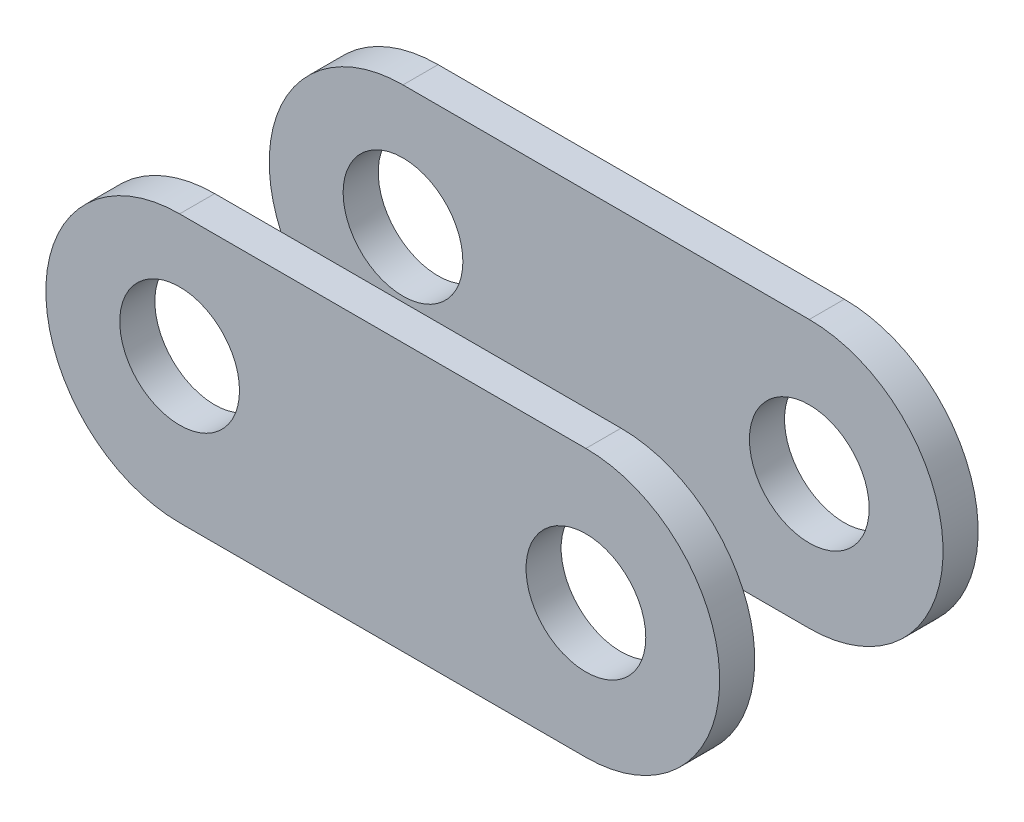
from build123d import *

# Parameters (mm, degrees)
BOSS_EXTRUDE1_DEPTH      = 3.9751
BOSS_EXTRUDE1_DEPTH_BACK = 3.9751
SKETCH2_R                = 1.8415
SKETCH3_W                = 20.7264
SKETCH3_H                = 5.7912
CUT_EXTRUDE1_DEPTH       = 17.369503444


with BuildPart() as part:
    # Sketch2 → Boss-Extrude1 (new, two sides: drawn at the far end of the back side and taken through both)
    with BuildSketch(Plane.XY.offset(-BOSS_EXTRUDE1_DEPTH_BACK)):
        with BuildLine():
            Line((-9.465807749, 4.1148), (3.030992251, 4.1148))
            ThreePointArc((3.030992251, 4.1148), (7.145792251, 0), (3.030992251, -4.1148))
            Line((3.030992251, -4.1148), (-9.465807749, -4.1148))
            ThreePointArc((-9.465807749, -4.1148), (-13.580607749, 0), (-9.465807749, 4.1148))
        make_face()
        with Locations((-9.465807749, 0.328058785)):
            Circle(SKETCH2_R, mode=Mode.SUBTRACT)
        with Locations((3.030992251, 0)):
            Circle(SKETCH2_R, mode=Mode.SUBTRACT)
    extrude(amount=BOSS_EXTRUDE1_DEPTH + BOSS_EXTRUDE1_DEPTH_BACK)

    # Sketch3 → Cut-Extrude1 (cut, through all)
    with BuildSketch(Plane(origin=(0, 4.1148, 0), x_dir=(1, 0, 0), z_dir=(0, 1, 0))):
        with Locations((-3.217407749, 0)):
            Rectangle(SKETCH3_W, SKETCH3_H)
    extrude(amount=-CUT_EXTRUDE1_DEPTH, mode=Mode.SUBTRACT)


with BuildPart() as cut_extrude1_piece_1:
    # of the separate pieces the step leaves, piece 1, a body of its own (cut_extrude1_pieces)
    add(part.part.solids().sort_by_distance((3.030992251, -4.1148, 2.8956))[0])


with BuildPart() as cut_extrude1_piece_2:
    # of the separate pieces the step leaves, piece 2, a body of its own (cut_extrude1_pieces)
    add(part.part.solids().sort_by_distance((3.030992251, -4.1148, -3.9751))[0])


solid = Compound([cut_extrude1_piece_1.part, cut_extrude1_piece_2.part])
